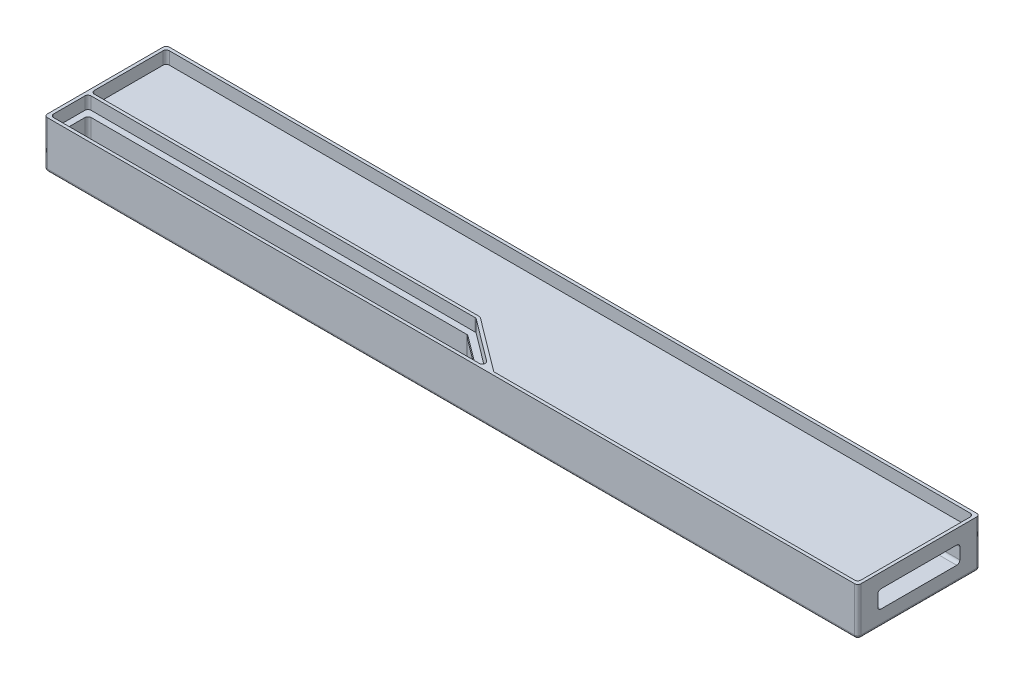
from build123d import *

# Parameters (mm, degrees)
EXTRUDE_1_DEPTH     = 7.6
CUT_EXTRUDE_1_DEPTH = 2
CUT_EXTRUDE_2_DEPTH = 66.965312855
CUT_EXTRUDE_START   = -1.6
CUT_EXTRUDE_3_DEPTH = 1.6
CUT_EXTRUDE_START_2 = -3.3
CUT_EXTRUDE_4_DEPTH = 3.3
CUT_EXTRUDE_5_DEPTH = 10
FILLET_1_R          = 0.5


with BuildPart() as part:
    # Эскиз1 → Бобышка-Вытянуть1 (new body)
    with BuildSketch(Plane(origin=(0, 0, 0), x_dir=(1, 0, 0), z_dir=(0, 1, 0))):
        with BuildLine():
            Line((-64.5, 9.75), (64.5, 9.75))
            ThreePointArc((64.5, 9.75), (64.853553391, 9.603553391), (65, 9.25))
            Line((65, 9.25), (65, -9.25))
            ThreePointArc((65, -9.25), (64.853553391, -9.603553391), (64.5, -9.75))
            Line((64.5, -9.75), (-64.5, -9.75))
            ThreePointArc((-64.5, -9.75), (-64.853553391, -9.603553391), (-65, -9.25))
            Line((-65, -9.25), (-65, 9.25))
            ThreePointArc((-65, 9.25), (-64.853553391, 9.603553391), (-64.5, 9.75))
        make_face()
    extrude(amount=EXTRUDE_1_DEPTH)

    # Эскиз2 → Вырез-Вытянуть1 (cut)
    with BuildSketch(Plane(origin=(0, 7.6, 0), x_dir=(1, 0, 0), z_dir=(0, 1, 0))):
        with BuildLine():
            Line((-64, -3.25), (-2.666666667, -3.25))
            ThreePointArc((-2.666666667, -3.25), (-2.508552784, -3.275658351), (-2.366666667, -3.35))
            Line((-2.366666667, -3.35), (4.3, -8.35))
            ThreePointArc((4.3, -8.35), (4.474341649, -8.908113883), (4, -9.25))
            Line((4, -9.25), (-64, -9.25))
            ThreePointArc((-64, -9.25), (-64.353553391, -9.103553391), (-64.5, -8.75))
            Line((-64.5, -8.75), (-64.5, -3.75))
            ThreePointArc((-64.5, -3.75), (-64.353553391, -3.396446609), (-64, -3.25))
        make_face()
        with BuildLine():
            Line((-64, 9.25), (64, 9.25))
            ThreePointArc((64, 9.25), (64.353553391, 9.103553391), (64.5, 8.75))
            Line((64.5, 8.75), (64.5, -8.75))
            ThreePointArc((64.5, -8.75), (64.353553391, -9.103553391), (64, -9.25))
            Line((64, -9.25), (6.5, -9.25))
            ThreePointArc((6.5, -9.25), (6.341886117, -9.224341649), (6.2, -9.15))
            Line((6.2, -9.15), (-2.2, -2.85))
            ThreePointArc((-2.2, -2.85), (-2.341886117, -2.775658351), (-2.5, -2.75))
            Line((-2.5, -2.75), (-64, -2.75))
            ThreePointArc((-64, -2.75), (-64.353553391, -2.603553391), (-64.5, -2.25))
            Line((-64.5, -2.25), (-64.5, 8.75))
            ThreePointArc((-64.5, 8.75), (-64.353553391, 9.103553391), (-64, 9.25))
        make_face()
    extrude(amount=-CUT_EXTRUDE_1_DEPTH, mode=Mode.SUBTRACT)

    # Эскиз6 → Вырез-Вытянуть2 (cut, through all)
    with BuildSketch(Plane(origin=(0, 5.6, 0), x_dir=(1, 0, 0), z_dir=(0, 1, 0))):
        with BuildLine():
            Line((-2.995152274, -4.238199232), (-63, -4.238199232))
            ThreePointArc((-63, -4.238199232), (-63.353553391, -4.384645841), (-63.5, -4.738199232))
            Line((-63.5, -4.738199232), (-63.5, -7.75))
            ThreePointArc((-63.5, -7.75), (-63.353553391, -8.103553391), (-63, -8.25))
            Line((-63, -8.25), (1.020582083, -8.25))
            ThreePointArc((1.020582083, -8.25), (1.494923732, -7.908113883), (1.320582083, -7.35))
            Line((1.320582083, -7.35), (-2.695152274, -4.338199232))
            ThreePointArc((-2.695152274, -4.338199232), (-2.837038391, -4.263857583), (-2.995152274, -4.238199232))
        make_face()
    extrude(amount=-CUT_EXTRUDE_2_DEPTH, mode=Mode.SUBTRACT)

    # Эскиз7 → Вырез-Вытянуть3 (cut)
    with BuildSketch(Plane.XZ.offset(CUT_EXTRUDE_START)):
        with BuildLine():
            Line((-63, 4.25), (59.5, 4.25))
            ThreePointArc((59.5, 4.25), (59.853553391, 4.396446609), (60, 4.75))
            Line((60, 4.75), (60, 7.75))
            ThreePointArc((60, 7.75), (59.853553391, 8.103553391), (59.5, 8.25))
            Line((59.5, 8.25), (-63, 8.25))
            ThreePointArc((-63, 8.25), (-63.353553391, 8.103553391), (-63.5, 7.75))
            Line((-63.5, 7.75), (-63.5, 4.75))
            ThreePointArc((-63.5, 4.75), (-63.353553391, 4.396446609), (-63, 4.25))
        make_face()
        with BuildLine():
            Line((59.5, -7.75), (41, -7.75))
            ThreePointArc((41, -7.75), (40.646446609, -7.603553391), (40.5, -7.25))
            Line((40.5, -7.25), (40.5, 1.75))
            ThreePointArc((40.5, 1.75), (40.646446609, 2.103553391), (41, 2.25))
            Line((41, 2.25), (59.5, 2.25))
            ThreePointArc((59.5, 2.25), (59.853553391, 2.103553391), (60, 1.75))
            Line((60, 1.75), (60, -7.25))
            ThreePointArc((60, -7.25), (59.853553391, -7.603553391), (59.5, -7.75))
        make_face()
        with BuildLine():
            Line((-61.74, -8.15), (-61.76, -8.15))
            ThreePointArc((-61.76, -8.15), (-62.990365799, -7.640365799), (-63.5, -6.41))
            Line((-63.5, -6.41), (-63.5, 1.11))
            ThreePointArc((-63.5, 1.11), (-62.990365799, 2.340365799), (-61.76, 2.85))
            Line((-61.76, 2.85), (-61.74, 2.85))
            ThreePointArc((-61.74, 2.85), (-60.509634201, 2.340365799), (-60, 1.11))
            Line((-60, 1.11), (-60, -6.41))
            ThreePointArc((-60, -6.41), (-60.509634201, -7.640365799), (-61.74, -8.15))
        make_face()
    extrude(amount=CUT_EXTRUDE_3_DEPTH, mode=Mode.SUBTRACT)

    # Эскиз8 → Вырез-Вытянуть4 (cut)
    with BuildSketch(Plane.XZ.offset(-1.6).offset(CUT_EXTRUDE_START_2)):
        with BuildLine():
            Line((-63, 8.25), (40, 8.25))
            ThreePointArc((40, 8.25), (40.353553391, 8.103553391), (40.5, 7.75))
            Line((40.5, 7.75), (40.5, 4.75))
            ThreePointArc((40.5, 4.75), (40.353553391, 4.396446609), (40, 4.25))
            Line((40, 4.25), (-63, 4.25))
            ThreePointArc((-63, 4.25), (-63.353553391, 4.396446609), (-63.5, 4.75))
            Line((-63.5, 4.75), (-63.5, 7.75))
            ThreePointArc((-63.5, 7.75), (-63.353553391, 8.103553391), (-63, 8.25))
        make_face()
    extrude(amount=CUT_EXTRUDE_4_DEPTH, mode=Mode.SUBTRACT)

    # Эскиз9 → Вырез-Вытянуть5 (cut)
    with BuildSketch(Plane(origin=(65, 0, 0), x_dir=(0, 0, -1), z_dir=(1, 0, 0))):
        with BuildLine():
            Line((-6.05, 5.3), (6.05, 5.3))
            ThreePointArc((6.05, 5.3), (6.403553391, 5.153553391), (6.55, 4.8))
            Line((6.55, 4.8), (6.55, 3))
            ThreePointArc((6.55, 3), (6.403553391, 2.646446609), (6.05, 2.5))
            Line((6.05, 2.5), (-6.05, 2.5))
            ThreePointArc((-6.05, 2.5), (-6.403553391, 2.646446609), (-6.55, 3))
            Line((-6.55, 3), (-6.55, 4.8))
            ThreePointArc((-6.55, 4.8), (-6.403553391, 5.153553391), (-6.05, 5.3))
        make_face()
    extrude(amount=-CUT_EXTRUDE_5_DEPTH, mode=Mode.SUBTRACT)

    # Скругление1
    fillet_1_edges = [part.edges().sort_by_distance(p)[0] for p in [
        (64.853553391, 0, 9.603553391),
        (64.853553391, 0, -9.603553391),
        (-64.853553391, 0, 9.603553391),
        (-64.853553391, 0, -9.603553391),
        (-65, 0, 0),
        (0, 0, 9.75),
        (65, 0, 0),
        (0, 0, -9.75),
    ]]
    fillet(fillet_1_edges, radius=FILLET_1_R)


solid = part.part
